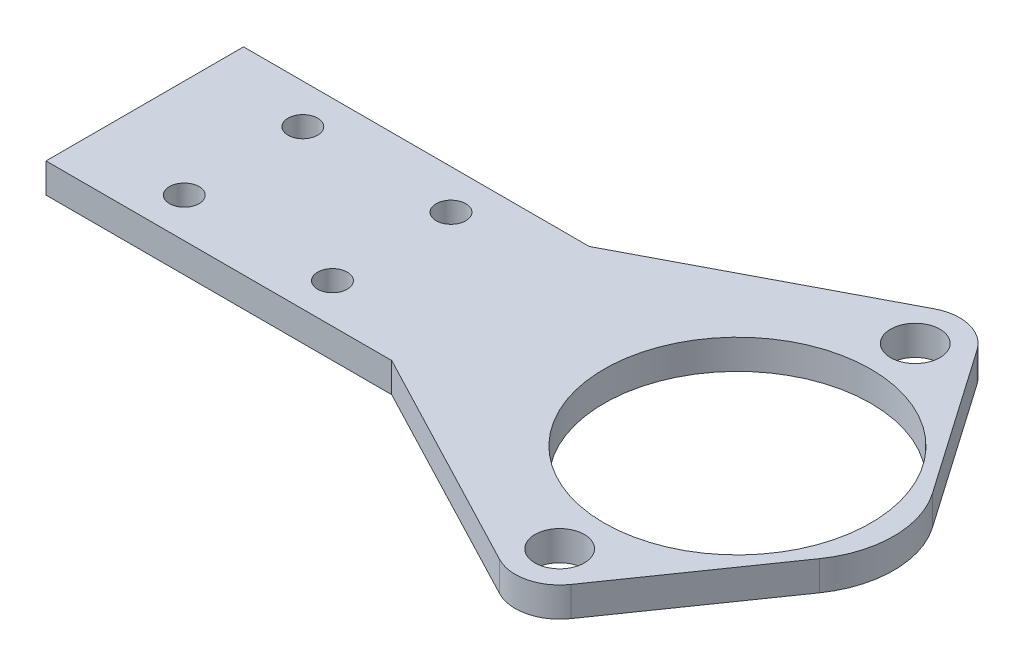
from build123d import *

# Parameters (mm, degrees)
SKETCH_1_R      = 1.5
SKETCH_1_R_2    = 2.5
SKETCH_1_R_3    = 13.5
EXTRUDE_1_DEPTH = 3


with BuildPart() as part:
    # 草图1 → 凸台-拉伸1 (new body)
    with BuildSketch(Plane(origin=(0, 0, 0), x_dir=(1, 0, 0), z_dir=(0, 1, 0))):
        with BuildLine():
            Line((-4.074096104, 31.987414165), (-26.988304094, 20))
            Line((-26.988304094, 20), (-61.988304094, 20))
            Line((-61.988304094, 20), (-61.988304094, 0))
            Line((-61.988304094, 0), (-26.988304094, 0))
            Line((-26.988304094, 0), (-4.073988277, -11.986991053))
            ThreePointArc((-4.073988277, -11.986991053), (-0.915951204, -12.370033292), (1.70627689, -10.568967126))
            Line((1.70627689, -10.568967126), (12.040704178, 4.290603619))
            ThreePointArc((12.040704178, 4.290603619), (13.372924736, 7.008443131), (13.830961877, 10.000376486))
            ThreePointArc((13.830961877, 10.000376486), (13.372859144, 12.992278245), (12.040591308, 15.710070854))
            Line((12.040591308, 15.710070854), (1.705755282, 30.569602652))
            ThreePointArc((1.705755282, 30.569602652), (-0.916306729, 32.37048168), (-4.074096104, 31.987414165))
        make_face()
        with Locations((-51.988304094, 4)):
            Circle(SKETCH_1_R, mode=Mode.SUBTRACT)
        with Locations((-36.988304094, 4)):
            Circle(SKETCH_1_R, mode=Mode.SUBTRACT)
        with Locations((-1.988107145, -7.999623513)):
            Circle(SKETCH_1_R_2, mode=Mode.SUBTRACT)
        with Locations((-51.988304094, 16)):
            Circle(SKETCH_1_R, mode=Mode.SUBTRACT)
        with Locations((-36.988304094, 16)):
            Circle(SKETCH_1_R, mode=Mode.SUBTRACT)
        with Locations((-1.988304094, 10.000376486)):
            Circle(SKETCH_1_R_3, mode=Mode.SUBTRACT)
        with Locations((-1.988304094, 28.000376486)):
            Circle(SKETCH_1_R_2, mode=Mode.SUBTRACT)
    extrude(amount=EXTRUDE_1_DEPTH)


solid = part.part
